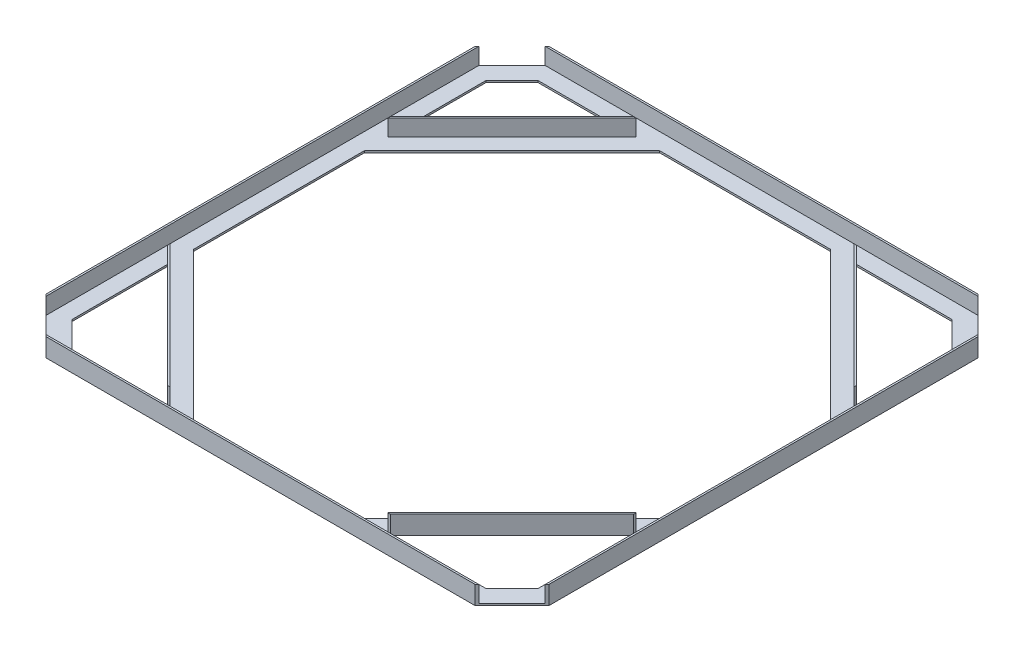
from build123d import *

# Parameters (mm, degrees)
SKETCH1_W            = 819
SKETCH1_H            = 819
SKETCH1_W_2          = 759
SKETCH1_H_2          = 759
BOSS_EXTRUDE1_DEPTH  = 3
SKETCH2_W            = 819
SKETCH2_H            = 819
SKETCH2_W_2          = 813
SKETCH2_H_2          = 813
BOSS_EXTRUDE2_DEPTH  = 27
BOSS_EXTRUDE3_DEPTH  = 3
CUT_EXTRUDE1_DEPTH   = 130
BOSS_EXTRUDE4_DEPTH  = 3
BOSS_EXTRUDE5_DEPTH  = 27
CUT_EXTRUDE2_DEPTH   = 163
MIRROR3_DEPTH        = 30
MIRROR3_2_DEPTH      = 3
MIRROR4_DEPTH        = 30
MIRROR4_2_DEPTH      = 3
CUT_EXTRUDE3_START   = -673
CUT_EXTRUDE3_DEPTH   = 1124
CUT_EXTRUDE4_DEPTH   = 300
BOSS_EXTRUDE8_DEPTH  = 3
BOSS_EXTRUDE9_DEPTH  = 27
BOSS_EXTRUDE10_DEPTH = 3
CUT_EXTRUDE9_DEPTH   = 266
CUT_EXTRUDE10_DEPTH  = 27
CUT_EXTRUDE11_DEPTH  = 27
BOSS_EXTRUDE13_DEPTH = 27
BOSS_EXTRUDE15_DEPTH = 3
BOSS_EXTRUDE16_DEPTH = 27
MIRROR17_DEPTH       = 3
MIRROR17_START       = 3
MIRROR17_2_DEPTH     = 27
MIRROR26_DEPTH       = 3
MIRROR26_START       = 3
MIRROR26_2_DEPTH     = 27


# Read off the part's stored shape, not the designer's step: Mirror3, Mirror4, Mirror17, Mirror26
with BuildPart() as part:
    # Sketch1 → Boss-Extrude1 (new body)
    with BuildSketch(Plane(origin=(0, 0, 0), x_dir=(1, 0, 0), z_dir=(0, 1, 0))):
        Rectangle(SKETCH1_W, SKETCH1_H)
        Rectangle(SKETCH1_W_2, SKETCH1_H_2, mode=Mode.SUBTRACT)
    extrude(amount=BOSS_EXTRUDE1_DEPTH)

    # Sketch2 → Boss-Extrude2 (add)
    with BuildSketch(Plane(origin=(0, 3, 0), x_dir=(1, 0, 0), z_dir=(0, 1, 0))):
        Rectangle(SKETCH2_W, SKETCH2_H)
        Rectangle(SKETCH2_W_2, SKETCH2_H_2, mode=Mode.SUBTRACT)
    extrude(amount=BOSS_EXTRUDE2_DEPTH)

    # Sketch3 → Boss-Extrude3 (add)
    with BuildSketch(Plane.XZ):
        Polygon((-294.643593129, 379.5), (-337.07, 379.5), (-379.5, 337.07), (-379.5, 294.643593129), align=None)
    extrude(amount=-BOSS_EXTRUDE3_DEPTH)

    # Sketch4 → Cut-Extrude1 (cut)
    with BuildSketch(Plane(origin=(0, 0, 0), x_dir=(-1, 0, 0), z_dir=(0, -1, 0))):
        Polygon((358.285, -358.285), (409.5, -307.07), (409.5, -409.5), (307.07, -409.5), align=None)
    extrude(amount=-CUT_EXTRUDE1_DEPTH, mode=Mode.SUBTRACT)

    # Sketch7 → Boss-Extrude4 (add)
    with BuildSketch(Plane(origin=(0, 0, 0), x_dir=(-1, 0, 0), z_dir=(0, -1, 0))):
        Polygon((409.5, -109.080101268), (409.5, -73.724762208), (73.724762208, -409.5), (109.080101268, -409.5), align=None)
    extrude(amount=-BOSS_EXTRUDE4_DEPTH)

    # Sketch8 → Boss-Extrude5 (add)
    with BuildSketch(Plane(origin=(0, 3, 0), x_dir=(1, 0, 0), z_dir=(0, 1, 0))):
        Polygon((-406.5, -76.724762208), (-406.5, -80.967402896), (-80.967402896, -406.5), (-76.724762208, -406.5), align=None)
    extrude(amount=BOSS_EXTRUDE5_DEPTH)

    # Sketch10 → Cut-Extrude2 (cut)
    with BuildSketch(Plane(origin=(0, 0, 0), x_dir=(-1, 0, 0), z_dir=(0, -1, 0))):
        Polygon((0, -409.5), (0, 0), (409.5, 0), (409.5, 409.5), (-409.5, 409.5), (-409.5, -409.5), align=None)
    extrude(amount=-CUT_EXTRUDE2_DEPTH, mode=Mode.SUBTRACT)

    # Mirror3 outline → Mirror3 (add)
    with BuildSketch(Plane(origin=(0, 0, 0), x_dir=(1, 0, 0), z_dir=(0, 1, 0))):
        Polygon((406.5, -76.724762208), (76.724762208, -406.5), (0, -406.5), (0, -409.5), (307.07, -409.5), (310.07, -406.5), (80.967402896, -406.5), (406.5, -80.967402896), (406.5, -310.07), (409.5, -307.07), (409.5, 0), (406.5, 0), align=None)
    extrude(amount=MIRROR3_DEPTH)

    # Mirror3 2 outline → Mirror3 2 (add)
    # profile 1 of 3: a face of its own
    with BuildSketch(Plane(origin=(0, 0, 0), x_dir=(1, 0, 0), z_dir=(0, 1, 0))):
        Polygon((0, -406.5), (76.724762208, -406.5), (103.724762208, -379.5), (0, -379.5), align=None)
    # profile 2 of 3: a face of its own
    with BuildSketch(Plane(origin=(0, 0, 0), x_dir=(1, 0, 0), z_dir=(0, 1, 0))):
        Polygon((379.5, 0), (379.5, -103.724762208), (406.5, -76.724762208), (406.5, 0), align=None)
    # profile 3 of 3: a face of its own
    with BuildSketch(Plane(origin=(0, 0, 0), x_dir=(1, 0, 0), z_dir=(0, 1, 0))):
        Polygon((80.967402896, -406.5), (310.07, -406.5), (406.5, -310.07), (406.5, -80.967402896), align=None)
        Polygon((379.5, -294.643593129), (294.643593129, -379.5), (139.080101268, -379.5), (379.5, -139.080101268), align=None, mode=Mode.SUBTRACT)
    extrude(amount=MIRROR3_2_DEPTH)

    # Mirror4 outline → Mirror4 (add)
    with BuildSketch(Plane(origin=(0, 0, 0), x_dir=(1, 0, 0), z_dir=(0, 1, 0))):
        Polygon((-409.5, 0), (-406.5, 0), (-406.5, 76.724762208), (-76.724762208, 406.5), (76.724762208, 406.5), (406.5, 76.724762208), (406.5, 0), (409.5, 0), (409.5, 307.07), (406.5, 310.07), (406.5, 80.967402896), (80.967402896, 406.5), (310.07, 406.5), (307.07, 409.5), (-307.07, 409.5), (-310.07, 406.5), (-80.967402896, 406.5), (-406.5, 80.967402896), (-406.5, 310.07), (-409.5, 307.07), align=None)
    extrude(amount=MIRROR4_DEPTH)

    # Mirror4 2 outline → Mirror4 2 (add)
    # profile 1 of 5: a face of its own
    with BuildSketch(Plane(origin=(0, 0, 0), x_dir=(1, 0, 0), z_dir=(0, 1, 0))):
        Polygon((-406.5, 76.724762208), (-406.5, 0), (-379.5, 0), (-379.5, 103.724762208), align=None)
    # profile 2 of 5: a face of its own
    with BuildSketch(Plane(origin=(0, 0, 0), x_dir=(1, 0, 0), z_dir=(0, 1, 0))):
        Polygon((-76.724762208, 406.5), (-103.724762208, 379.5), (103.724762208, 379.5), (76.724762208, 406.5), align=None)
    # profile 3 of 5: a face of its own
    with BuildSketch(Plane(origin=(0, 0, 0), x_dir=(1, 0, 0), z_dir=(0, 1, 0))):
        Polygon((-310.07, 406.5), (-406.5, 310.07), (-406.5, 80.967402896), (-80.967402896, 406.5), align=None)
        Polygon((-139.080101268, 379.5), (-379.5, 139.080101268), (-379.5, 294.643593129), (-294.643593129, 379.5), align=None, mode=Mode.SUBTRACT)
    # profile 4 of 5: a face of its own
    with BuildSketch(Plane(origin=(0, 0, 0), x_dir=(1, 0, 0), z_dir=(0, 1, 0))):
        Polygon((406.5, 76.724762208), (379.5, 103.724762208), (379.5, 0), (406.5, 0), align=None)
    # profile 5 of 5: a face of its own
    with BuildSketch(Plane(origin=(0, 0, 0), x_dir=(1, 0, 0), z_dir=(0, 1, 0))):
        Polygon((406.5, 310.07), (310.07, 406.5), (80.967402896, 406.5), (406.5, 80.967402896), align=None)
        Polygon((294.643593129, 379.5), (379.5, 294.643593129), (379.5, 139.080101268), (139.080101268, 379.5), align=None, mode=Mode.SUBTRACT)
    extrude(amount=MIRROR4_2_DEPTH)

    # Sketch12 → Cut-Extrude3 (cut)
    with BuildSketch(Plane(origin=(0, 0, 0), x_dir=(-1, 0, 0), z_dir=(0, -1, 0)).offset(CUT_EXTRUDE3_START)):
        Polygon((379.5, -337.07), (379.5, -294.643593129), (294.643593129, -379.5), (337.07, -379.5), align=None)
    extrude(amount=CUT_EXTRUDE3_DEPTH, mode=Mode.SUBTRACT)

    # Sketch13 → Cut-Extrude4 (cut)
    with BuildSketch(Plane.XZ):
        Polygon((-409.5, 0), (0, 0), (0, 409.5), (505.643397908, 433.197413997), (586.960318624, -390.321219438), (40.755373804, -460.11749056), (-470.159650687, -449.460798141), align=None)
    extrude(amount=-CUT_EXTRUDE4_DEPTH, mode=Mode.SUBTRACT)

    # Sketch14 → Boss-Extrude8 (add)
    with BuildSketch(Plane.XZ):
        Polygon((-409.5, 307.07), (-307.07, 409.5), (-335.354271247, 409.5), (-409.5, 335.354271247), align=None)
    extrude(amount=-BOSS_EXTRUDE8_DEPTH)

    # Sketch16 → Boss-Extrude9 (add)
    with BuildSketch(Plane(origin=(0, 3, 0), x_dir=(1, 0, 0), z_dir=(0, 1, 0))):
        Polygon((-409.5, -307.07), (-406.5, -310.07), (-406.5, -338.354271247), (-409.5, -335.354271247), align=None)
        Polygon((-307.07, -409.5), (-310.07, -406.5), (-338.354271247, -406.5), (-335.354271247, -409.5), align=None)
    extrude(amount=BOSS_EXTRUDE9_DEPTH)

    # Sketch17 → Boss-Extrude10 (add)
    with BuildSketch(Plane(origin=(0, 0, 0), x_dir=(-1, 0, 0), z_dir=(0, -1, 0))):
        Polygon((181.506508139, -379.5), (379.5, -181.506508139), (379.5, -139.080101268), (139.080101268, -379.5), align=None)
    extrude(amount=-BOSS_EXTRUDE10_DEPTH)

    # Sketch18 → Cut-Extrude9 (cut)
    with BuildSketch(Plane(origin=(0, 0, 0), x_dir=(-1, 0, 0), z_dir=(0, -1, 0))):
        Polygon((379.5, -103.724762208), (103.724762208, -379.5), (139.080101268, -379.5), (379.5, -139.080101268), align=None)
    extrude(amount=-CUT_EXTRUDE9_DEPTH, mode=Mode.SUBTRACT)

    # Sketch19 → Cut-Extrude10 (cut)
    with BuildSketch(Plane(origin=(0, 30, 0), x_dir=(1, 0, 0), z_dir=(0, 1, 0))):
        Polygon((-406.5, -80.967402896), (-406.5, -76.724762208), (-379.5, -103.724762208), (-379.5, -107.967402896), align=None)
    extrude(amount=-CUT_EXTRUDE10_DEPTH, mode=Mode.SUBTRACT)

    # Sketch20 → Cut-Extrude11 (cut)
    with BuildSketch(Plane(origin=(0, 30, 0), x_dir=(1, 0, 0), z_dir=(0, 1, 0))):
        Polygon((-107.967402896, -379.5), (-103.724762208, -379.5), (-76.724762208, -406.5), (-80.967402896, -406.5), align=None)
    extrude(amount=-CUT_EXTRUDE11_DEPTH, mode=Mode.SUBTRACT)

    # Sketch21 → Boss-Extrude13 (add)
    with BuildSketch(Plane(origin=(0, 3, 0), x_dir=(1, 0, 0), z_dir=(0, 1, 0))):
        Polygon((-379.5, -181.506508139), (-181.506508139, -379.5), (-177.263867452, -379.5), (-379.5, -177.263867452), align=None)
    extrude(amount=BOSS_EXTRUDE13_DEPTH)

    # Sketch22 → Boss-Extrude15 (add)
    with BuildSketch(Plane(origin=(0, 0, 0), x_dir=(-1, 0, 0), z_dir=(0, -1, 0))):
        Polygon((409.5, -335.354271247), (335.354271247, -409.5), (349.496406871, -409.5), (409.5, -349.496406871), align=None)
    extrude(amount=-BOSS_EXTRUDE15_DEPTH)

    # Sketch23 → Boss-Extrude16 (add)
    with BuildSketch(Plane(origin=(0, 3, 0), x_dir=(1, 0, 0), z_dir=(0, 1, 0))):
        Polygon((-406.5, -338.354271247), (-409.5, -335.354271247), (-409.5, -349.496406871), (-406.5, -352.496406871), align=None)
        Polygon((-338.354271247, -406.5), (-352.496406871, -406.5), (-349.496406871, -409.5), (-335.354271247, -409.5), align=None)
    extrude(amount=BOSS_EXTRUDE16_DEPTH)

    # Mirror17 outline → Mirror17 (add)
    with BuildSketch(Plane(origin=(0, 0, 0), x_dir=(1, 0, 0), z_dir=(0, 1, 0))):
        Polygon((379.5, -139.080101268), (139.080101268, -379.5), (0, -379.5), (0, -409.5), (349.496406871, -409.5), (409.5, -349.496406871), (409.5, 0), (379.5, 0), align=None)
        Polygon((379.5, -337.07), (337.07, -379.5), (181.506508139, -379.5), (379.5, -181.506508139), align=None, mode=Mode.SUBTRACT)
    extrude(amount=MIRROR17_DEPTH)

    # Mirror17 2 outline → Mirror17 2 (add)
    with BuildSketch(Plane(origin=(0, 0, 0), x_dir=(1, 0, 0), z_dir=(0, 1, 0)).offset(MIRROR17_START)):
        Polygon((352.496406871, -406.5), (0, -406.5), (0, -409.5), (349.496406871, -409.5), align=None)
        Polygon((409.5, 0), (406.5, 0), (406.5, -352.496406871), (409.5, -349.496406871), align=None)
        Polygon((177.263867452, -379.5), (181.506508139, -379.5), (379.5, -181.506508139), (379.5, -177.263867452), align=None)
    extrude(amount=MIRROR17_2_DEPTH)

    # Mirror26 outline → Mirror26 (add)
    with BuildSketch(Plane(origin=(0, 0, 0), x_dir=(1, 0, 0), z_dir=(0, 1, 0))):
        Polygon((-379.5, 0), (-379.5, 139.080101268), (-139.080101268, 379.5), (139.080101268, 379.5), (379.5, 139.080101268), (379.5, 0), (409.5, 0), (409.5, 349.496406871), (349.496406871, 409.5), (-349.496406871, 409.5), (-409.5, 349.496406871), (-409.5, 0), align=None)
        Polygon((-337.07, 379.5), (-181.506508139, 379.5), (-379.5, 181.506508139), (-379.5, 337.07), align=None, mode=Mode.SUBTRACT)
        Polygon((337.07, 379.5), (379.5, 337.07), (379.5, 181.506508139), (181.506508139, 379.5), align=None, mode=Mode.SUBTRACT)
    extrude(amount=MIRROR26_DEPTH)

    # Mirror26 2 outline → Mirror26 2 (add)
    with BuildSketch(Plane(origin=(0, 0, 0), x_dir=(1, 0, 0), z_dir=(0, 1, 0)).offset(MIRROR26_START)):
        Polygon((-409.5, 0), (-406.5, 0), (-406.5, 352.496406871), (-409.5, 349.496406871), align=None)
        Polygon((-349.496406871, 409.5), (-352.496406871, 406.5), (352.496406871, 406.5), (349.496406871, 409.5), align=None)
        Polygon((409.5, 349.496406871), (406.5, 352.496406871), (406.5, 0), (409.5, 0), align=None)
        Polygon((-181.506508139, 379.5), (-379.5, 181.506508139), (-379.5, 177.263867452), (-177.263867452, 379.5), align=None)
        Polygon((379.5, 177.263867452), (379.5, 181.506508139), (181.506508139, 379.5), (177.263867452, 379.5), align=None)
    extrude(amount=MIRROR26_2_DEPTH)


solid = part.part
